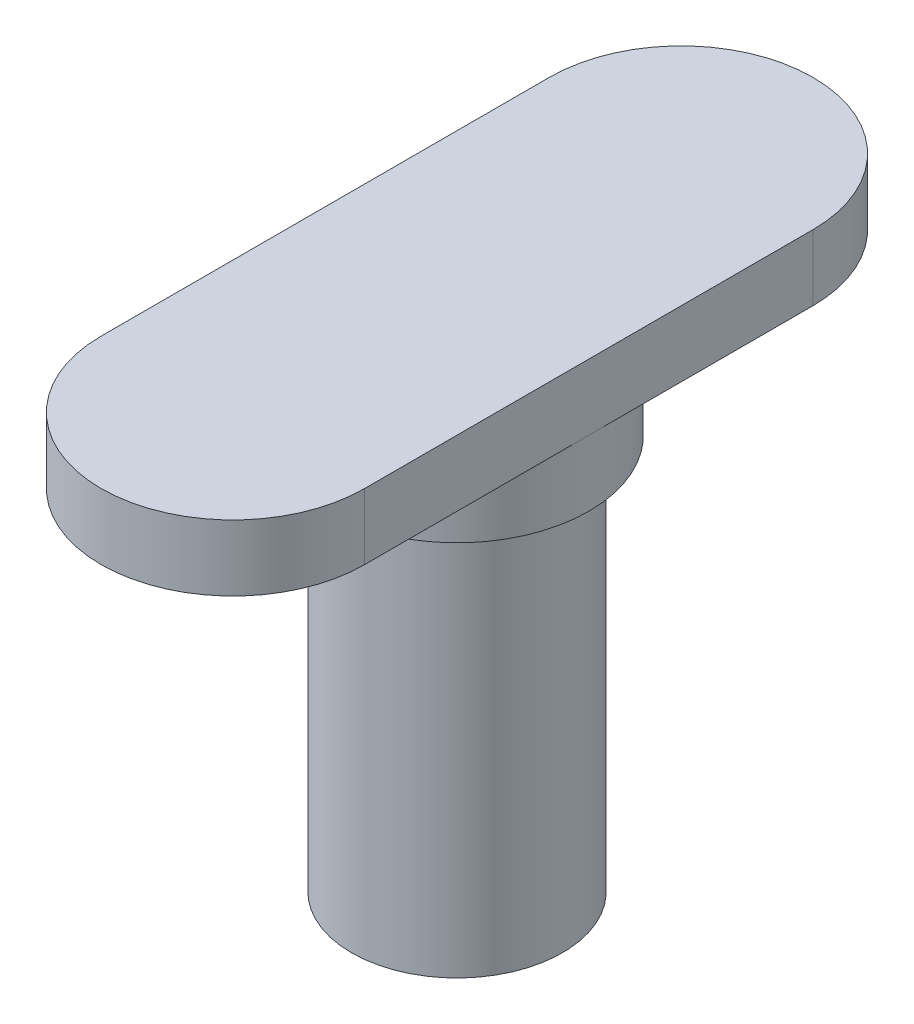
from build123d import *

# Parameters (mm, degrees)
SKETCH3_R                 = 4
BOSS_EXTRUDE1_DEPTH       = 15
BOSS_EXTRUDE2_START       = 15
SKETCH3_3_R               = 5
BOSS_EXTRUDE2_DEPTH       = 5
BOSS_EXTRUDE3_START       = 20
BOSS_EXTRUDE3_DEPTH       = 2.5
CUT_EXTRUDE1_DEPTH        = 15
GRUB_START                = -4.0000001
GRUB_SCREW_HOLE_OUTLINE_R = 1.5
GRUB_SCREW_HOLE_DEPTH     = 3.0000001


# Read off the part's stored shape, not the designer's step: Grub Screw Hole
with BuildPart() as part:
    # Sketch3 → Boss-Extrude1 (new body)
    with BuildSketch(Plane(origin=(0, 0, 0), x_dir=(1, 0, 0), z_dir=(0, 1, 0))):
        with Locations(Location((0, 0, 0), (0, 0, 270))):
            Circle(SKETCH3_R)
    extrude(amount=BOSS_EXTRUDE1_DEPTH)

    # Sketch3<3> → Boss-Extrude2 (add)
    with BuildSketch(Plane(origin=(0, 0, 0), x_dir=(1, 0, 0), z_dir=(0, 1, 0)).offset(BOSS_EXTRUDE2_START)):
        with Locations(Location((0, 0, 0), (0, 0, 270))):
            Circle(SKETCH3_3_R)
    extrude(amount=BOSS_EXTRUDE2_DEPTH)

    # Sketch3<5> → Boss-Extrude3 (add)
    with BuildSketch(Plane(origin=(0, 0, 0), x_dir=(1, 0, 0), z_dir=(0, 1, 0)).offset(BOSS_EXTRUDE3_START)):
        with BuildLine():
            Line((-5, -8.5), (-5, 8.5))
            ThreePointArc((-5, 8.5), (0, 13.5), (5, 8.5))
            Line((5, 8.5), (5, -8.5))
            ThreePointArc((5, -8.5), (0, -13.5), (-5, -8.5))
        make_face()
    extrude(amount=-BOSS_EXTRUDE3_DEPTH)

    # Sketch5 → Cut-Extrude1 (cut)
    with BuildSketch(Plane(origin=(0, 0, 0), x_dir=(1, 0, 0), z_dir=(0, 1, 0))):
        with BuildLine():
            ThreePointArc((2, 0), (1, 1.732050808), (-1, 1.732050808))
            Line((-1, 1.732050808), (-1, -1.732050808))
            ThreePointArc((-1, -1.732050808), (1, -1.732050808), (2, 0))
        make_face()
    extrude(amount=CUT_EXTRUDE1_DEPTH, mode=Mode.SUBTRACT)

    # Grub Screw Hole outline → Grub Screw Hole (cut)
    with BuildSketch(Plane(origin=(0, 0, 0), x_dir=(0, 0, -1), z_dir=(1, 0, 0)).offset(GRUB_START)):
        with Locations((0, 5)):
            Circle(GRUB_SCREW_HOLE_OUTLINE_R)
    extrude(amount=GRUB_SCREW_HOLE_DEPTH, mode=Mode.SUBTRACT)


solid = part.part
